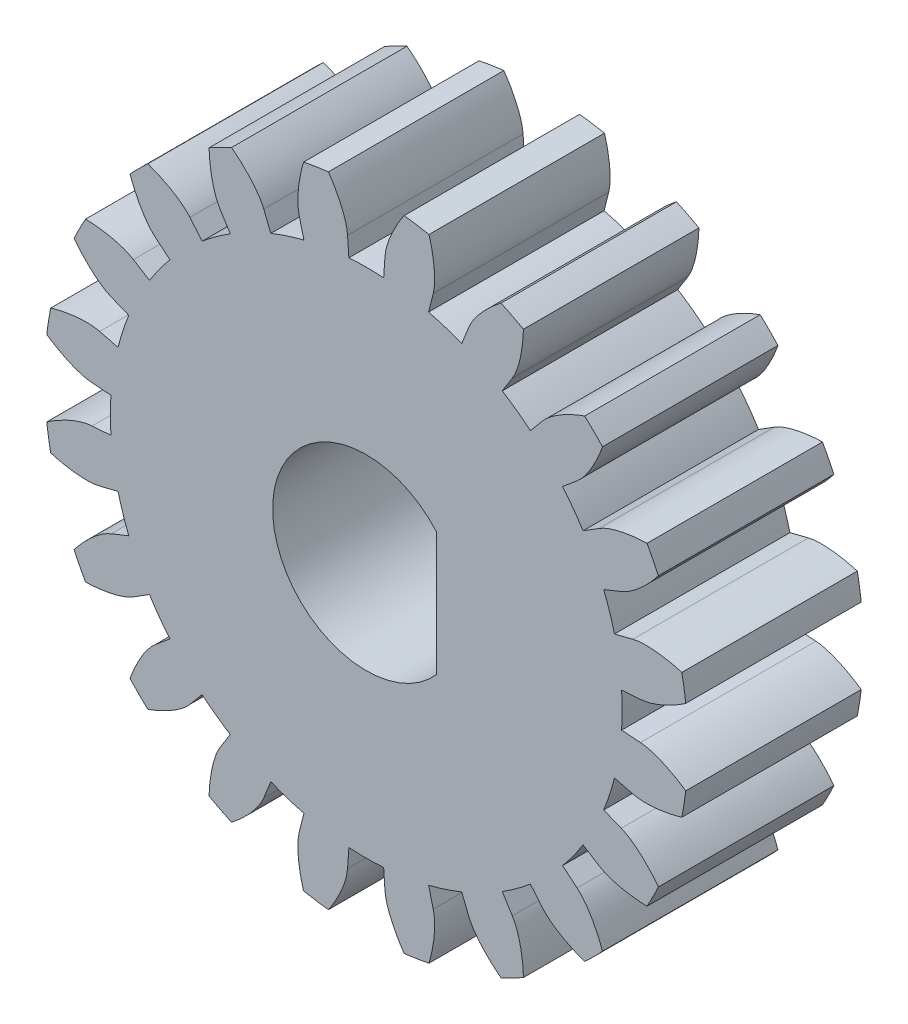
from build123d import *

# Parameters (mm, degrees)
SKETCH_1_R               = 5.5
SKETCH_1_R_2             = 1.6
EXTRUDE_1_DEPTH          = 3
CUT_EXTRUDE_1_DEPTH      = 9.336666
PATTERN_CIRCULAR_1_DEPTH = 3
EXTRUDE_2_DEPTH          = 3


# Read off the part's stored shape, not the designer's step: 阵列(圆周)1
with BuildPart() as part:
    # 草图1 → 凸台-拉伸1 (new body)
    with BuildSketch(Plane.XY):
        Circle(SKETCH_1_R)
        Circle(SKETCH_1_R_2, mode=Mode.SUBTRACT)
    extrude(amount=EXTRUDE_1_DEPTH)

    # 草图1<3> → 切除-拉伸1 (cut, through all)
    with BuildSketch(Plane.XY):
        with BuildLine():
            Line((4.68759624, 0.319369739), (4.364881259, 0.297382905))
            ThreePointArc((4.364881259, 0.297382905), (4.372469583, 0.148777503), (4.375, 0))
            ThreePointArc((4.375, 0), (4.372469583, -0.148777503), (4.364881259, -0.297382905))
            Line((4.364881259, -0.297382905), (4.68759624, -0.319369739))
            add(Edge.make_bspline(
                [(4.68759624, -0.319369739), (4.723328518, -0.321804208), (4.822539562, -0.336024472), (5.006239619, -0.392562489), (5.199142564, -0.482491423), (5.35109765, -0.572850293), (5.444197274, -0.635344688), (5.461765036, -0.647396861)],
                knots=[0, 0, 0, 0, 0, 0.005604068, 0.015718248, 0.029959916, 0.033300536, 0.033300536, 0.033300536, 0.033300536, 0.033300536], degree=4))
            ThreePointArc((5.461765036, -0.647396861), (5.490432938, -0.324262474), (5.5, 0))
            ThreePointArc((5.5, 0), (5.490432938, 0.324262474), (5.461765036, 0.647396861))
            add(Edge.make_bspline(
                [(4.68759624, 0.319369739), (4.723328518, 0.321804208), (4.822539562, 0.336024472), (5.006239619, 0.392562489), (5.199142564, 0.482491423), (5.35109765, 0.572850293), (5.444197274, 0.635344688), (5.461765036, 0.647396861)],
                knots=[0, 0, 0, 0, 0, 0.005604068, 0.015718248, 0.029959916, 0.033300536, 0.033300536, 0.033300536, 0.033300536, 0.033300536], degree=4))
        make_face()
    extrude(amount=CUT_EXTRUDE_1_DEPTH, mode=Mode.SUBTRACT)

    # 阵列(圆周)1 outline → 阵列(圆周)1 (cut)
    with BuildSketch(Plane.XY):
        with BuildLine():
            Line((4.243145136, 1.065994538), (4.556859627, 1.14480823))
            add(Edge.make_bspline(
                [(4.556859627, 1.14480823), (4.591595335, 1.153534793), (4.690344948, 1.170668417), (4.882525293, 1.173664007), (5.093776464, 1.147746796), (5.266216765, 1.108767108), (5.374071599, 1.078100773), (5.39450386, 1.072067212)],
                knots=[0, 0, 0, 0, 0, 0.005604068, 0.015718248, 0.029959916, 0.033300536, 0.033300536, 0.033300536, 0.033300536, 0.033300536], degree=4))
            ThreePointArc((5.39450386, 1.072067212), (5.23081084, 1.699593469), (4.994390596, 2.303489219))
            add(Edge.make_bspline(
                [(4.359478273, 1.752285572), (4.392709397, 1.765642771), (4.482670403, 1.809824945), (4.639908332, 1.920362233), (4.795580365, 2.065500021), (4.912175813, 2.198393117), (4.981406987, 2.286598184), (4.994390596, 2.303489219)],
                knots=[0, 0, 0, 0, 0, 0.005604068, 0.015718248, 0.029959916, 0.033300536, 0.033300536, 0.033300536, 0.033300536, 0.033300536], degree=4))
            Line((4.359478273, 1.752285572), (4.059352393, 1.631650437))
            ThreePointArc((4.059352393, 1.631650437), (4.160872259, 1.35194935), (4.243145136, 1.065994538))
        make_face()
        with BuildLine():
            add(Edge.make_bspline(
                [(4.359478273, -1.752285572), (4.392709397, -1.765642771), (4.482670403, -1.809824945), (4.639908332, -1.920362233), (4.795580365, -2.065500021), (4.912175813, -2.198393117), (4.981406987, -2.286598184), (4.994390595, -2.303489218)],
                knots=[0, 0, 0, 0, 0, 0.005604068, 0.015718248, 0.029959916, 0.033300536, 0.033300536, 0.033300536, 0.033300536, 0.033300536], degree=4))
            ThreePointArc((4.994390595, -2.303489218), (5.23081084, -1.699593469), (5.39450386, -1.072067212))
            add(Edge.make_bspline(
                [(4.556859627, -1.14480823), (4.591595335, -1.153534793), (4.690344948, -1.170668417), (4.882525293, -1.173664007), (5.093776464, -1.147746796), (5.266216765, -1.108767108), (5.374071599, -1.078100773), (5.39450386, -1.072067212)],
                knots=[0, 0, 0, 0, 0, 0.005604068, 0.015718248, 0.029959916, 0.033300536, 0.033300536, 0.033300536, 0.033300536, 0.033300536], degree=4))
            Line((4.556859627, -1.14480823), (4.243145136, -1.065994538))
            ThreePointArc((4.243145136, -1.065994538), (4.160872259, -1.35194935), (4.059352393, -1.631650437))
            Line((4.059352393, -1.631650437), (4.359478273, -1.752285572))
        make_face()
        with BuildLine():
            add(Edge.make_bspline(
                [(3.604624198, -3.013675485), (3.632101274, -3.036647918), (3.704006232, -3.106467142), (3.819390489, -3.260183543), (3.922593347, -3.446323085), (3.992415983, -3.608741904), (4.031001877, -3.714023518), (4.038130406, -3.734100002)],
                knots=[0, 0, 0, 0, 0, 0.005604068, 0.015718248, 0.029959916, 0.033300536, 0.033300536, 0.033300536, 0.033300536, 0.033300536], degree=4))
            ThreePointArc((4.038130406, -3.734100002), (4.449593469, -3.232818888), (4.799191061, -2.686589877))
            add(Edge.make_bspline(
                [(3.980065843, -2.496924392), (4.010404809, -2.515957772), (4.099026691, -2.562768124), (4.280875372, -2.625004093), (4.489796033, -2.665635562), (4.665841891, -2.681850659), (4.777894353, -2.686014218), (4.799191061, -2.686589877)],
                knots=[0, 0, 0, 0, 0, 0.005604068, 0.015718248, 0.029959916, 0.033300536, 0.033300536, 0.033300536, 0.033300536, 0.033300536], degree=4))
            Line((3.980065843, -2.496924392), (3.706060403, -2.325025008))
            ThreePointArc((3.706060403, -2.325025008), (3.53944935, -2.571560479), (3.356465831, -2.806200656))
            Line((3.356465831, -2.806200656), (3.604624198, -3.013675485))
        make_face()
        with BuildLine():
            add(Edge.make_bspline(
                [(2.496924392, -3.980065843), (2.515957772, -4.010404809), (2.562768124, -4.099026691), (2.625004093, -4.280875372), (2.665635562, -4.489796033), (2.681850659, -4.665841891), (2.686014218, -4.777894353), (2.686589877, -4.79919106)],
                knots=[0, 0, 0, 0, 0, 0.005604068, 0.015718248, 0.029959916, 0.033300536, 0.033300536, 0.033300536, 0.033300536, 0.033300536], degree=4))
            ThreePointArc((2.686589877, -4.79919106), (3.232818888, -4.449593469), (3.734100002, -4.038130406))
            add(Edge.make_bspline(
                [(3.013675485, -3.604624198), (3.036647918, -3.632101274), (3.106467142, -3.704006232), (3.260183543, -3.819390489), (3.446323085, -3.922593347), (3.608741904, -3.992415983), (3.714023518, -4.031001877), (3.734100002, -4.038130406)],
                knots=[0, 0, 0, 0, 0, 0.005604068, 0.015718248, 0.029959916, 0.033300536, 0.033300536, 0.033300536, 0.033300536, 0.033300536], degree=4))
            Line((3.013675485, -3.604624198), (2.806200656, -3.356465831))
            ThreePointArc((2.806200656, -3.356465831), (2.571560479, -3.53944935), (2.325025008, -3.706060403))
            Line((2.325025008, -3.706060403), (2.496924392, -3.980065843))
        make_face()
        with BuildLine():
            add(Edge.make_bspline(
                [(1.14480823, -4.556859627), (1.153534793, -4.591595335), (1.170668417, -4.690344948), (1.173664007, -4.882525293), (1.147746796, -5.093776464), (1.108767108, -5.266216765), (1.078100773, -5.374071599), (1.072067212, -5.39450386)],
                knots=[0, 0, 0, 0, 0, 0.005604068, 0.015718248, 0.029959916, 0.033300536, 0.033300536, 0.033300536, 0.033300536, 0.033300536], degree=4))
            ThreePointArc((1.072067212, -5.39450386), (1.699593469, -5.23081084), (2.303489219, -4.994390596))
            add(Edge.make_bspline(
                [(1.752285572, -4.359478273), (1.765642771, -4.392709397), (1.809824945, -4.482670403), (1.920362233, -4.639908332), (2.065500021, -4.795580365), (2.198393117, -4.912175813), (2.286598184, -4.981406987), (2.303489219, -4.994390596)],
                knots=[0, 0, 0, 0, 0, 0.005604068, 0.015718248, 0.029959916, 0.033300536, 0.033300536, 0.033300536, 0.033300536, 0.033300536], degree=4))
            Line((1.752285572, -4.359478273), (1.631650437, -4.059352393))
            ThreePointArc((1.631650437, -4.059352393), (1.35194935, -4.160872259), (1.065994538, -4.243145136))
            Line((1.065994538, -4.243145136), (1.14480823, -4.556859627))
        make_face()
        with BuildLine():
            add(Edge.make_bspline(
                [(-0.319369739, -4.68759624), (-0.321804208, -4.723328518), (-0.336024472, -4.822539562), (-0.392562489, -5.006239619), (-0.482491423, -5.199142564), (-0.572850293, -5.35109765), (-0.635344688, -5.444197274), (-0.647396861, -5.461765036)],
                knots=[0, 0, 0, 0, 0, 0.005604068, 0.015718248, 0.029959916, 0.033300536, 0.033300536, 0.033300536, 0.033300536, 0.033300536], degree=4))
            ThreePointArc((-0.647396861, -5.461765036), (0, -5.5), (0.647396861, -5.461765036))
            add(Edge.make_bspline(
                [(0.319369739, -4.68759624), (0.321804208, -4.723328518), (0.336024472, -4.822539562), (0.392562489, -5.006239619), (0.482491423, -5.199142564), (0.572850293, -5.35109765), (0.635344688, -5.444197274), (0.647396861, -5.461765036)],
                knots=[0, 0, 0, 0, 0, 0.005604068, 0.015718248, 0.029959916, 0.033300536, 0.033300536, 0.033300536, 0.033300536, 0.033300536], degree=4))
            Line((0.319369739, -4.68759624), (0.297382905, -4.364881259))
            ThreePointArc((0.297382905, -4.364881259), (0, -4.375), (-0.297382905, -4.364881259))
            Line((-0.297382905, -4.364881259), (-0.319369739, -4.68759624))
        make_face()
        with BuildLine():
            add(Edge.make_bspline(
                [(-1.752285572, -4.359478273), (-1.765642771, -4.392709397), (-1.809824945, -4.482670403), (-1.920362233, -4.639908332), (-2.065500021, -4.795580365), (-2.198393117, -4.912175813), (-2.286598184, -4.981406987), (-2.303489218, -4.994390595)],
                knots=[0, 0, 0, 0, 0, 0.005604068, 0.015718248, 0.029959916, 0.033300536, 0.033300536, 0.033300536, 0.033300536, 0.033300536], degree=4))
            ThreePointArc((-2.303489218, -4.994390595), (-1.699593469, -5.23081084), (-1.072067212, -5.39450386))
            add(Edge.make_bspline(
                [(-1.14480823, -4.556859627), (-1.153534793, -4.591595335), (-1.170668417, -4.690344948), (-1.173664007, -4.882525293), (-1.147746796, -5.093776464), (-1.108767108, -5.266216765), (-1.078100773, -5.374071599), (-1.072067212, -5.39450386)],
                knots=[0, 0, 0, 0, 0, 0.005604068, 0.015718248, 0.029959916, 0.033300536, 0.033300536, 0.033300536, 0.033300536, 0.033300536], degree=4))
            Line((-1.14480823, -4.556859627), (-1.065994538, -4.243145136))
            ThreePointArc((-1.065994538, -4.243145136), (-1.35194935, -4.160872259), (-1.631650437, -4.059352393))
            Line((-1.631650437, -4.059352393), (-1.752285572, -4.359478273))
        make_face()
        with BuildLine():
            add(Edge.make_bspline(
                [(-3.013675485, -3.604624198), (-3.036647918, -3.632101274), (-3.106467142, -3.704006232), (-3.260183543, -3.819390489), (-3.446323085, -3.922593347), (-3.608741904, -3.992415983), (-3.714023518, -4.031001877), (-3.734100002, -4.038130406)],
                knots=[0, 0, 0, 0, 0, 0.005604068, 0.015718248, 0.029959916, 0.033300536, 0.033300536, 0.033300536, 0.033300536, 0.033300536], degree=4))
            ThreePointArc((-3.734100002, -4.038130406), (-3.232818888, -4.449593469), (-2.686589877, -4.79919106))
            add(Edge.make_bspline(
                [(-2.496924392, -3.980065843), (-2.515957772, -4.010404809), (-2.562768124, -4.099026691), (-2.625004093, -4.280875372), (-2.665635562, -4.489796033), (-2.681850659, -4.665841891), (-2.686014218, -4.777894353), (-2.686589877, -4.79919106)],
                knots=[0, 0, 0, 0, 0, 0.005604068, 0.015718248, 0.029959916, 0.033300536, 0.033300536, 0.033300536, 0.033300536, 0.033300536], degree=4))
            Line((-2.496924392, -3.980065843), (-2.325025008, -3.706060403))
            ThreePointArc((-2.325025008, -3.706060403), (-2.571560479, -3.53944935), (-2.806200656, -3.356465831))
            Line((-2.806200656, -3.356465831), (-3.013675485, -3.604624198))
        make_face()
        with BuildLine():
            add(Edge.make_bspline(
                [(-3.980065843, -2.496924392), (-4.010404809, -2.515957772), (-4.099026691, -2.562768124), (-4.280875372, -2.625004093), (-4.489796033, -2.665635562), (-4.665841891, -2.681850659), (-4.777894353, -2.686014218), (-4.79919106, -2.686589877)],
                knots=[0, 0, 0, 0, 0, 0.005604068, 0.015718248, 0.029959916, 0.033300536, 0.033300536, 0.033300536, 0.033300536, 0.033300536], degree=4))
            ThreePointArc((-4.79919106, -2.686589877), (-4.449593469, -3.232818888), (-4.038130406, -3.734100002))
            add(Edge.make_bspline(
                [(-3.604624198, -3.013675485), (-3.632101274, -3.036647918), (-3.704006232, -3.106467142), (-3.819390489, -3.260183543), (-3.922593347, -3.446323085), (-3.992415983, -3.608741904), (-4.031001877, -3.714023518), (-4.038130406, -3.734100002)],
                knots=[0, 0, 0, 0, 0, 0.005604068, 0.015718248, 0.029959916, 0.033300536, 0.033300536, 0.033300536, 0.033300536, 0.033300536], degree=4))
            Line((-3.604624198, -3.013675485), (-3.356465831, -2.806200656))
            ThreePointArc((-3.356465831, -2.806200656), (-3.53944935, -2.571560479), (-3.706060403, -2.325025008))
            Line((-3.706060403, -2.325025008), (-3.980065843, -2.496924392))
        make_face()
        with BuildLine():
            add(Edge.make_bspline(
                [(-4.556859627, -1.14480823), (-4.591595335, -1.153534793), (-4.690344948, -1.170668417), (-4.882525293, -1.173664007), (-5.093776464, -1.147746796), (-5.266216765, -1.108767108), (-5.374071599, -1.078100773), (-5.39450386, -1.072067212)],
                knots=[0, 0, 0, 0, 0, 0.005604068, 0.015718248, 0.029959916, 0.033300536, 0.033300536, 0.033300536, 0.033300536, 0.033300536], degree=4))
            ThreePointArc((-5.39450386, -1.072067212), (-5.23081084, -1.699593469), (-4.994390596, -2.303489218))
            add(Edge.make_bspline(
                [(-4.359478273, -1.752285572), (-4.392709397, -1.765642771), (-4.482670403, -1.809824945), (-4.639908332, -1.920362233), (-4.795580365, -2.065500021), (-4.912175813, -2.198393117), (-4.981406987, -2.286598184), (-4.994390596, -2.303489218)],
                knots=[0, 0, 0, 0, 0, 0.005604068, 0.015718248, 0.029959916, 0.033300536, 0.033300536, 0.033300536, 0.033300536, 0.033300536], degree=4))
            Line((-4.359478273, -1.752285572), (-4.059352393, -1.631650437))
            ThreePointArc((-4.059352393, -1.631650437), (-4.160872259, -1.35194935), (-4.243145136, -1.065994538))
            Line((-4.243145136, -1.065994538), (-4.556859627, -1.14480823))
        make_face()
        with BuildLine():
            add(Edge.make_bspline(
                [(-4.68759624, 0.319369739), (-4.723328518, 0.321804208), (-4.822539562, 0.336024472), (-5.006239619, 0.392562489), (-5.199142564, 0.482491423), (-5.35109765, 0.572850293), (-5.444197274, 0.635344688), (-5.461765036, 0.647396861)],
                knots=[0, 0, 0, 0, 0, 0.005604068, 0.015718248, 0.029959916, 0.033300536, 0.033300536, 0.033300536, 0.033300536, 0.033300536], degree=4))
            ThreePointArc((-5.461765036, 0.647396861), (-5.5, 0), (-5.461765036, -0.647396861))
            add(Edge.make_bspline(
                [(-4.68759624, -0.319369739), (-4.723328518, -0.321804208), (-4.822539562, -0.336024472), (-5.006239619, -0.392562489), (-5.199142564, -0.482491423), (-5.35109765, -0.572850293), (-5.444197274, -0.635344688), (-5.461765036, -0.647396861)],
                knots=[0, 0, 0, 0, 0, 0.005604068, 0.015718248, 0.029959916, 0.033300536, 0.033300536, 0.033300536, 0.033300536, 0.033300536], degree=4))
            Line((-4.68759624, -0.319369739), (-4.364881259, -0.297382905))
            ThreePointArc((-4.364881259, -0.297382905), (-4.375, 0), (-4.364881259, 0.297382905))
            Line((-4.364881259, 0.297382905), (-4.68759624, 0.319369739))
        make_face()
        with BuildLine():
            add(Edge.make_bspline(
                [(-4.359478273, 1.752285572), (-4.392709397, 1.765642771), (-4.482670403, 1.809824945), (-4.639908332, 1.920362233), (-4.795580365, 2.065500021), (-4.912175813, 2.198393117), (-4.981406987, 2.286598184), (-4.994390595, 2.303489218)],
                knots=[0, 0, 0, 0, 0, 0.005604068, 0.015718248, 0.029959916, 0.033300536, 0.033300536, 0.033300536, 0.033300536, 0.033300536], degree=4))
            ThreePointArc((-4.994390595, 2.303489218), (-5.23081084, 1.699593469), (-5.39450386, 1.072067212))
            add(Edge.make_bspline(
                [(-4.556859627, 1.14480823), (-4.591595335, 1.153534793), (-4.690344948, 1.170668417), (-4.882525293, 1.173664007), (-5.093776464, 1.147746796), (-5.266216765, 1.108767108), (-5.374071599, 1.078100773), (-5.39450386, 1.072067212)],
                knots=[0, 0, 0, 0, 0, 0.005604068, 0.015718248, 0.029959916, 0.033300536, 0.033300536, 0.033300536, 0.033300536, 0.033300536], degree=4))
            Line((-4.556859627, 1.14480823), (-4.243145136, 1.065994538))
            ThreePointArc((-4.243145136, 1.065994538), (-4.160872259, 1.35194935), (-4.059352393, 1.631650437))
            Line((-4.059352393, 1.631650437), (-4.359478273, 1.752285572))
        make_face()
        with BuildLine():
            add(Edge.make_bspline(
                [(-3.604624198, 3.013675485), (-3.632101274, 3.036647918), (-3.704006232, 3.106467142), (-3.819390489, 3.260183543), (-3.922593347, 3.446323085), (-3.992415983, 3.608741904), (-4.031001877, 3.714023518), (-4.038130406, 3.734100002)],
                knots=[0, 0, 0, 0, 0, 0.005604068, 0.015718248, 0.029959916, 0.033300536, 0.033300536, 0.033300536, 0.033300536, 0.033300536], degree=4))
            ThreePointArc((-4.038130406, 3.734100002), (-4.449593469, 3.232818888), (-4.79919106, 2.686589877))
            add(Edge.make_bspline(
                [(-3.980065843, 2.496924392), (-4.010404809, 2.515957772), (-4.099026691, 2.562768124), (-4.280875372, 2.625004093), (-4.489796033, 2.665635562), (-4.665841891, 2.681850659), (-4.777894353, 2.686014218), (-4.79919106, 2.686589877)],
                knots=[0, 0, 0, 0, 0, 0.005604068, 0.015718248, 0.029959916, 0.033300536, 0.033300536, 0.033300536, 0.033300536, 0.033300536], degree=4))
            Line((-3.980065843, 2.496924392), (-3.706060403, 2.325025008))
            ThreePointArc((-3.706060403, 2.325025008), (-3.53944935, 2.571560479), (-3.356465831, 2.806200656))
            Line((-3.356465831, 2.806200656), (-3.604624198, 3.013675485))
        make_face()
        with BuildLine():
            add(Edge.make_bspline(
                [(-2.496924392, 3.980065843), (-2.515957772, 4.010404809), (-2.562768124, 4.099026691), (-2.625004093, 4.280875372), (-2.665635562, 4.489796033), (-2.681850659, 4.665841891), (-2.686014218, 4.777894353), (-2.686589877, 4.79919106)],
                knots=[0, 0, 0, 0, 0, 0.005604068, 0.015718248, 0.029959916, 0.033300536, 0.033300536, 0.033300536, 0.033300536, 0.033300536], degree=4))
            ThreePointArc((-2.686589877, 4.79919106), (-3.232818888, 4.449593469), (-3.734100002, 4.038130406))
            add(Edge.make_bspline(
                [(-3.013675485, 3.604624198), (-3.036647918, 3.632101274), (-3.106467142, 3.704006232), (-3.260183543, 3.819390489), (-3.446323085, 3.922593347), (-3.608741904, 3.992415983), (-3.714023518, 4.031001877), (-3.734100002, 4.038130406)],
                knots=[0, 0, 0, 0, 0, 0.005604068, 0.015718248, 0.029959916, 0.033300536, 0.033300536, 0.033300536, 0.033300536, 0.033300536], degree=4))
            Line((-3.013675485, 3.604624198), (-2.806200656, 3.356465831))
            ThreePointArc((-2.806200656, 3.356465831), (-2.571560479, 3.53944935), (-2.325025008, 3.706060403))
            Line((-2.325025008, 3.706060403), (-2.496924392, 3.980065843))
        make_face()
        with BuildLine():
            add(Edge.make_bspline(
                [(-1.14480823, 4.556859627), (-1.153534793, 4.591595335), (-1.170668417, 4.690344948), (-1.173664007, 4.882525293), (-1.147746796, 5.093776464), (-1.108767108, 5.266216765), (-1.078100773, 5.374071599), (-1.072067212, 5.39450386)],
                knots=[0, 0, 0, 0, 0, 0.005604068, 0.015718248, 0.029959916, 0.033300536, 0.033300536, 0.033300536, 0.033300536, 0.033300536], degree=4))
            ThreePointArc((-1.072067212, 5.39450386), (-1.699593469, 5.23081084), (-2.303489219, 4.994390596))
            add(Edge.make_bspline(
                [(-1.752285572, 4.359478273), (-1.765642771, 4.392709397), (-1.809824945, 4.482670403), (-1.920362233, 4.639908332), (-2.065500021, 4.795580365), (-2.198393117, 4.912175813), (-2.286598184, 4.981406987), (-2.303489219, 4.994390596)],
                knots=[0, 0, 0, 0, 0, 0.005604068, 0.015718248, 0.029959916, 0.033300536, 0.033300536, 0.033300536, 0.033300536, 0.033300536], degree=4))
            Line((-1.752285572, 4.359478273), (-1.631650437, 4.059352393))
            ThreePointArc((-1.631650437, 4.059352393), (-1.35194935, 4.160872259), (-1.065994538, 4.243145136))
            Line((-1.065994538, 4.243145136), (-1.14480823, 4.556859627))
        make_face()
        with BuildLine():
            add(Edge.make_bspline(
                [(0.319369739, 4.68759624), (0.321804208, 4.723328518), (0.336024472, 4.822539562), (0.392562489, 5.006239619), (0.482491423, 5.199142564), (0.572850293, 5.35109765), (0.635344688, 5.444197274), (0.647396861, 5.461765036)],
                knots=[0, 0, 0, 0, 0, 0.005604068, 0.015718248, 0.029959916, 0.033300536, 0.033300536, 0.033300536, 0.033300536, 0.033300536], degree=4))
            ThreePointArc((0.647396861, 5.461765036), (0, 5.5), (-0.647396861, 5.461765036))
            add(Edge.make_bspline(
                [(-0.319369739, 4.68759624), (-0.321804208, 4.723328518), (-0.336024472, 4.822539562), (-0.392562489, 5.006239619), (-0.482491423, 5.199142564), (-0.572850293, 5.35109765), (-0.635344688, 5.444197274), (-0.647396861, 5.461765036)],
                knots=[0, 0, 0, 0, 0, 0.005604068, 0.015718248, 0.029959916, 0.033300536, 0.033300536, 0.033300536, 0.033300536, 0.033300536], degree=4))
            Line((-0.319369739, 4.68759624), (-0.297382905, 4.364881259))
            ThreePointArc((-0.297382905, 4.364881259), (0, 4.375), (0.297382905, 4.364881259))
            Line((0.297382905, 4.364881259), (0.319369739, 4.68759624))
        make_face()
        with BuildLine():
            add(Edge.make_bspline(
                [(1.752285572, 4.359478273), (1.765642771, 4.392709397), (1.809824945, 4.482670403), (1.920362233, 4.639908332), (2.065500021, 4.795580365), (2.198393117, 4.912175813), (2.286598184, 4.981406987), (2.303489218, 4.994390595)],
                knots=[0, 0, 0, 0, 0, 0.005604068, 0.015718248, 0.029959916, 0.033300536, 0.033300536, 0.033300536, 0.033300536, 0.033300536], degree=4))
            ThreePointArc((2.303489218, 4.994390595), (1.699593469, 5.23081084), (1.072067212, 5.39450386))
            add(Edge.make_bspline(
                [(1.14480823, 4.556859627), (1.153534793, 4.591595335), (1.170668417, 4.690344948), (1.173664007, 4.882525293), (1.147746796, 5.093776464), (1.108767108, 5.266216765), (1.078100773, 5.374071599), (1.072067212, 5.39450386)],
                knots=[0, 0, 0, 0, 0, 0.005604068, 0.015718248, 0.029959916, 0.033300536, 0.033300536, 0.033300536, 0.033300536, 0.033300536], degree=4))
            Line((1.14480823, 4.556859627), (1.065994538, 4.243145136))
            ThreePointArc((1.065994538, 4.243145136), (1.35194935, 4.160872259), (1.631650437, 4.059352393))
            Line((1.631650437, 4.059352393), (1.752285572, 4.359478273))
        make_face()
        with BuildLine():
            add(Edge.make_bspline(
                [(3.013675485, 3.604624198), (3.036647918, 3.632101274), (3.106467142, 3.704006232), (3.260183543, 3.819390489), (3.446323085, 3.922593347), (3.608741904, 3.992415983), (3.714023518, 4.031001877), (3.734100002, 4.038130406)],
                knots=[0, 0, 0, 0, 0, 0.005604068, 0.015718248, 0.029959916, 0.033300536, 0.033300536, 0.033300536, 0.033300536, 0.033300536], degree=4))
            ThreePointArc((3.734100002, 4.038130406), (3.232818888, 4.449593469), (2.686589877, 4.799191061))
            add(Edge.make_bspline(
                [(2.496924392, 3.980065843), (2.515957772, 4.010404809), (2.562768124, 4.099026691), (2.625004093, 4.280875372), (2.665635562, 4.489796033), (2.681850659, 4.665841891), (2.686014218, 4.777894353), (2.686589877, 4.799191061)],
                knots=[0, 0, 0, 0, 0, 0.005604068, 0.015718248, 0.029959916, 0.033300536, 0.033300536, 0.033300536, 0.033300536, 0.033300536], degree=4))
            Line((2.496924392, 3.980065843), (2.325025008, 3.706060403))
            ThreePointArc((2.325025008, 3.706060403), (2.571560479, 3.53944935), (2.806200656, 3.356465831))
            Line((2.806200656, 3.356465831), (3.013675485, 3.604624198))
        make_face()
        with BuildLine():
            add(Edge.make_bspline(
                [(3.980065843, 2.496924392), (4.010404809, 2.515957772), (4.099026691, 2.562768124), (4.280875372, 2.625004093), (4.489796033, 2.665635562), (4.665841891, 2.681850659), (4.777894353, 2.686014218), (4.79919106, 2.686589877)],
                knots=[0, 0, 0, 0, 0, 0.005604068, 0.015718248, 0.029959916, 0.033300536, 0.033300536, 0.033300536, 0.033300536, 0.033300536], degree=4))
            ThreePointArc((4.79919106, 2.686589877), (4.449593469, 3.232818888), (4.038130406, 3.734100002))
            add(Edge.make_bspline(
                [(3.604624198, 3.013675485), (3.632101274, 3.036647918), (3.704006232, 3.106467142), (3.819390489, 3.260183543), (3.922593347, 3.446323085), (3.992415983, 3.608741904), (4.031001877, 3.714023518), (4.038130406, 3.734100002)],
                knots=[0, 0, 0, 0, 0, 0.005604068, 0.015718248, 0.029959916, 0.033300536, 0.033300536, 0.033300536, 0.033300536, 0.033300536], degree=4))
            Line((3.604624198, 3.013675485), (3.356465831, 2.806200656))
            ThreePointArc((3.356465831, 2.806200656), (3.53944935, 2.571560479), (3.706060403, 2.325025008))
            Line((3.706060403, 2.325025008), (3.980065843, 2.496924392))
        make_face()
    extrude(amount=PATTERN_CIRCULAR_1_DEPTH, mode=Mode.SUBTRACT)

    # 草图2 → 凸台-拉伸2 (add, through all)
    with BuildSketch(Plane(origin=(0, 0, 0), x_dir=(-1, 0, 0), z_dir=(0, 0, -1))):
        with BuildLine():
            Line((-1.2, -1.058300524), (-1.2, 1.058300524))
            ThreePointArc((-1.2, 1.058300524), (-1.6, 0), (-1.2, -1.058300524))
        make_face()
    extrude(amount=-EXTRUDE_2_DEPTH)


solid = part.part
